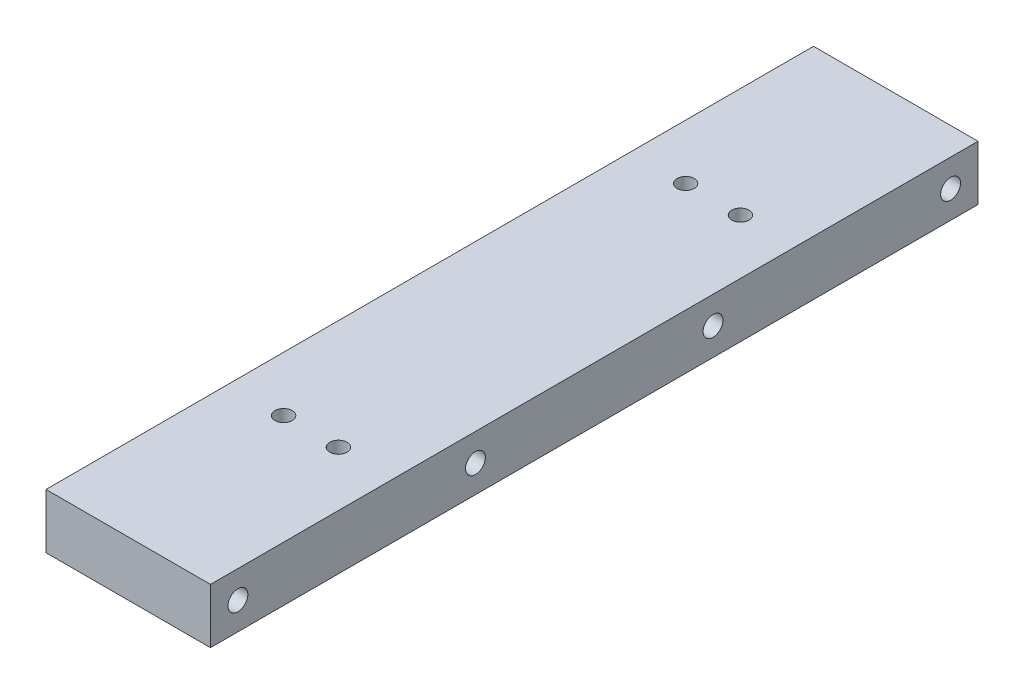
from build123d import *

# Parameters (mm, degrees)
SKETCH2_W             = 28.575
SKETCH2_H             = 133.35
BOSS_EXTRUDE1_DEPTH   = 9.525
F_5_CLEARANCE_HOLE1_D = 3.4544
LPATTERN1_COUNT       = 4
LPATTERN1_PITCH       = 41.275
SKETCH8_R             = 1.5
CUT_EXTRUDE2_DEPTH    = 137.709468399


with BuildPart() as part:
    # Sketch2 → Boss-Extrude1 (new body)
    with BuildSketch(Plane(origin=(0, 0, 0), x_dir=(1, 0, 0), z_dir=(0, 1, 0))):
        with Locations((14.2875, 66.675)):
            Rectangle(SKETCH2_W, SKETCH2_H)
    extrude(amount=BOSS_EXTRUDE1_DEPTH)

    # #5 Clearance Hole1 (through all)
    with Locations(Plane(origin=(28.575, 0, 0), x_dir=(0, 0, -1), z_dir=(1, 0, 0))):
        with Locations((4.7625, 4.7625)):
            f_5_clearance_hole1 = Hole(F_5_CLEARANCE_HOLE1_D / 2)

    # LPattern1: #5 Clearance Hole1 ×4
    with Locations(*[(0, 0, -i * LPATTERN1_PITCH) for i in range(1, LPATTERN1_COUNT)]):
        add(f_5_clearance_hole1, mode=Mode.SUBTRACT)

    # Sketch8 → Cut-Extrude2 (cut, through all)
    with BuildSketch(Plane.XZ):
        with Locations((9.525, -31.75)):
            Circle(SKETCH8_R)
        with Locations((9.525, -101.6)):
            Circle(SKETCH8_R)
        with Locations((19.05, -101.6)):
            Circle(SKETCH8_R)
        with Locations((19.05, -31.75)):
            Circle(SKETCH8_R)
    extrude(amount=-CUT_EXTRUDE2_DEPTH, mode=Mode.SUBTRACT)


solid = part.part
